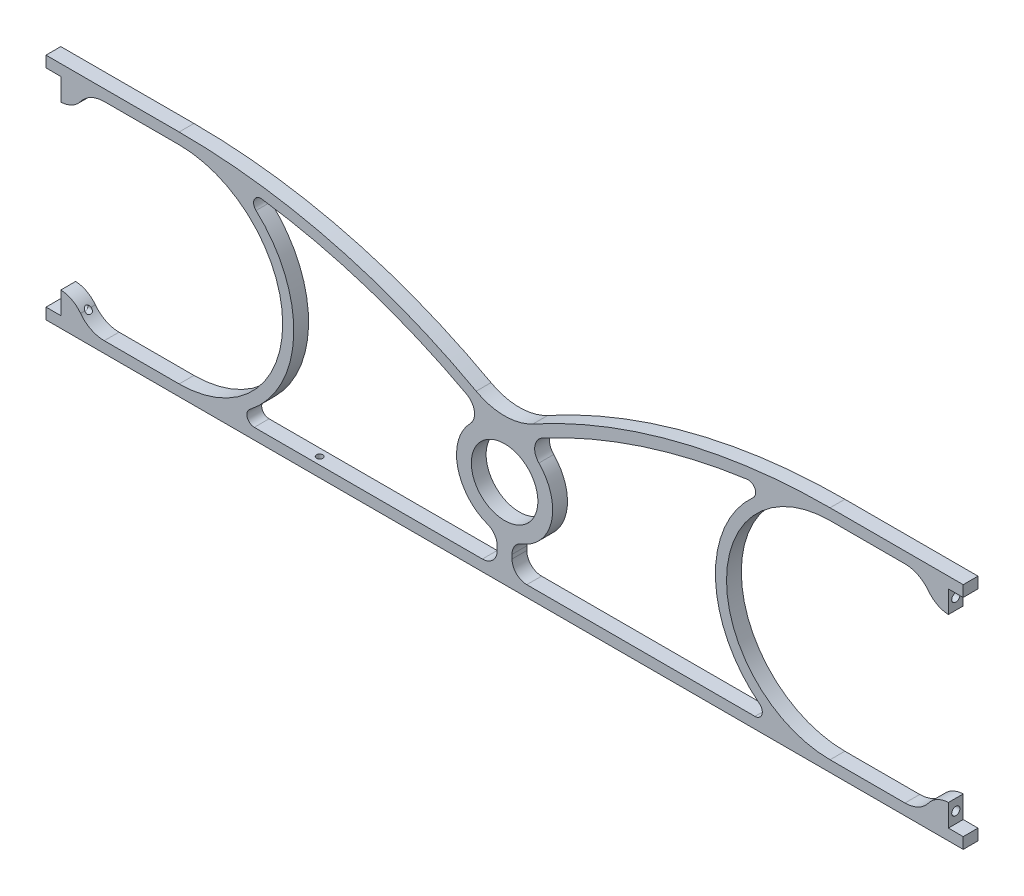
from build123d import *

# Parameters (mm, degrees)
SKETCH1_W                      = 6.35
SKETCH1_H                      = 4.7625
SKETCH1_R                      = 20.6375
SKETCH1_R_2                    = 14.2875
BOSS_EXTRUDE1_DEPTH            = 6.35
SKETCH2_W                      = 6.35
SKETCH2_H                      = 9.525
BOSS_EXTRUDE2_DEPTH            = 6.35
FILLET1_R                      = 12.7
FILLET2_R                      = 11.1125
F_6_32_TAPPED_HOLE1_D          = 2.7051
F_6_32_TAPPED_HOLE1_DEPTH      = 9.398
F_6_32_TAPPED_HOLE1_TIP        = 0.81269403
FILLET3_R                      = 25.4
FILLET4_R                      = 6.35
FILLET5_R                      = 3.175
F_6_32_TAPPED_HOLE2_AT_2_COUNT = 2
F_6_32_TAPPED_HOLE2_AT_2_PITCH = 79.375


with BuildPart() as part:
    # Sketch1 → Boss-Extrude1 (new body)
    # profile 1 of 11: a face of its own
    with BuildSketch(Plane.XY):
        with Locations((-193.675, -35.71875)):
            Rectangle(SKETCH1_W, SKETCH1_H)
    # profile 2 of 11: a face of its own
    with BuildSketch(Plane.XY):
        Polygon((190.5, -38.1), (190.5, -33.3375), (-118.579686171, -33.3375), (-190.5, -33.3375), (-190.5, -38.1), align=None)
    # profile 3 of 11: a face of its own
    with BuildSketch(Plane.XY):
        with BuildLine():
            ThreePointArc((-139.7, 55.5625), (-95.25, 11.1125), (-139.7, -33.3375))
            Line((-139.7, -33.3375), (-118.579686171, -33.3375))
            ThreePointArc((-118.579686171, -33.3375), (-90.5008099, 9.968013342), (-116.535631077, 54.53233612))
            ThreePointArc((-116.535631077, 54.53233612), (-128.106367855, 55.304831818), (-139.7, 55.5625))
        make_face()
    # profile 4 of 11: a face of its own
    with BuildSketch(Plane.XY):
        with Locations((-193.675, 57.94375)):
            Rectangle(SKETCH1_W, SKETCH1_H)
    # profile 5 of 11: a face of its own
    with BuildSketch(Plane.XY):
        with BuildLine():
            Line((-190.5, 55.5625), (-139.7, 55.5625))
            ThreePointArc((-139.7, 55.5625), (-128.106367855, 55.304831818), (-116.535631077, 54.53233612))
            ThreePointArc((-116.535631077, 54.53233612), (-59.866243781, 43.050732151), (-7.116346533, 19.371732454))
            ThreePointArc((-7.116346533, 19.371732454), (-3.614019765, 20.318594129), (0, 20.6375))
            ThreePointArc((0, 20.6375), (-67.085973021, 50.210624965), (-139.7, 60.325))
            Line((-139.7, 60.325), (-190.5, 60.325))
            Line((-190.5, 60.325), (-190.5, 55.5625))
        make_face()
    # profile 6 of 11: a face of its own
    with BuildSketch(Plane.XY):
        Circle(SKETCH1_R)
        Circle(SKETCH1_R_2, mode=Mode.SUBTRACT)
    # profile 7 of 11: a face of its own
    with BuildSketch(Plane.XY):
        with BuildLine():
            Line((-3.175, -33.3375), (3.175, -33.3375))
            Line((3.175, -33.3375), (3.175, -20.391806719))
            ThreePointArc((3.175, -20.391806719), (0, -20.6375), (-3.175, -20.391806719))
            Line((-3.175, -20.391806719), (-3.175, -33.3375))
        make_face()
    # profile 8 of 11: a face of its own
    with BuildSketch(Plane.XY):
        with BuildLine():
            ThreePointArc((116.535631077, 54.53233612), (128.106367855, 55.304831818), (139.7, 55.5625))
            Line((139.7, 55.5625), (190.5, 55.5625))
            Line((190.5, 55.5625), (190.5, 60.325))
            Line((190.5, 60.325), (139.7, 60.325))
            ThreePointArc((139.7, 60.325), (67.085973021, 50.210624965), (0, 20.6375))
            ThreePointArc((0, 20.6375), (3.614019765, 20.318594129), (7.116346533, 19.371732454))
            ThreePointArc((7.116346533, 19.371732454), (59.866243781, 43.050732151), (116.535631077, 54.53233612))
        make_face()
    # profile 9 of 11: a face of its own
    with BuildSketch(Plane.XY):
        with BuildLine():
            Line((118.579686171, -33.3375), (139.7, -33.3375))
            ThreePointArc((139.7, -33.3375), (95.25, 11.1125), (139.7, 55.5625))
            ThreePointArc((139.7, 55.5625), (128.106367855, 55.304831818), (116.535631077, 54.53233612))
            ThreePointArc((116.535631077, 54.53233612), (90.5008099, 9.968013342), (118.579686171, -33.3375))
        make_face()
    # profile 10 of 11: a face of its own
    with BuildSketch(Plane.XY):
        with Locations((193.675, 57.94375)):
            Rectangle(SKETCH1_W, SKETCH1_H)
    # profile 11 of 11: a face of its own
    with BuildSketch(Plane.XY):
        with Locations((193.675, -35.71875)):
            Rectangle(SKETCH1_W, SKETCH1_H)
    extrude(amount=-BOSS_EXTRUDE1_DEPTH)

    # Sketch2 → Boss-Extrude2 (add)
    with BuildSketch(Plane.XY):
        with Locations((-187.325, -28.575)):
            Rectangle(SKETCH2_W, SKETCH2_H)
        with Locations((-187.325, 50.8)):
            Rectangle(SKETCH2_W, SKETCH2_H)
        with Locations((187.325, 50.8)):
            Rectangle(SKETCH2_W, SKETCH2_H)
        with Locations((187.325, -28.575)):
            Rectangle(SKETCH2_W, SKETCH2_H)
    extrude(amount=-BOSS_EXTRUDE2_DEPTH)

    # Fillet1
    # the kernel refuses this fillet: 12.7 mm, written as the material it adds along each edge
    with BuildSketch(Plane(origin=(-184.15, 55.5625, 0), x_dir=(1, 0, 0), z_dir=(0, 0, -1)), Plane(origin=(184.15, -33.3375, 0), x_dir=(-1, 0, 0), z_dir=(0, 0, -1))) as fillet1_piece_1:
        with BuildLine():
            CenterArc((12.296722124, 12.7), FILLET1_R, 194.477512186, 75.522487814)
            Line((0, 9.525), (-0.245934442, 9.4615))
            ThreePointArc((-0.245934442, 9.4615), (-0.254, 4.7625), (-0.254, 0))
            Line((-0.254, 0), (0, -0.254))
            Line((0, -0.254), (12.296722124, -0.254))
            Line((12.296722124, -0.254), (12.296722124, 0))
        make_face()
    extrude(amount=6.35)
    with BuildSketch(Plane(origin=(184.15, 55.5625, 0), x_dir=(-1, 0, 0), z_dir=(0, 0, -1)), Plane(origin=(-184.15, -33.3375, 0), x_dir=(1, 0, 0), z_dir=(0, 0, -1))) as fillet1_piece_2:
        with BuildLine():
            CenterArc((12.296722124, -12.7), FILLET1_R, 90, 75.522487814)
            Line((0, -9.525), (-0.245934442, -9.4615))
            ThreePointArc((-0.245934442, -9.4615), (-0.254, -4.7625), (-0.254, 0))
            Line((-0.254, 0), (0, 0.254))
            Line((0, 0.254), (12.296722124, 0.254))
            Line((12.296722124, 0.254), (12.296722124, 0))
        make_face()
    extrude(amount=6.35)

    # Fillet2
    # the kernel refuses this fillet: 11.1125 mm, written as the material it takes off along each edge
    with BuildSketch(Plane(origin=(184.15, -23.8125, 15.875), x_dir=(-0.43306748122172567, -0.9013615016785831, 0), z_dir=(0, 0, -1)), Plane(origin=(-184.15, 46.0375, 15.875), x_dir=(0.43306748122172517, 0.9013615016785834, 0), z_dir=(0, 0, -1))) as fillet2_piece_1:
        with BuildLine():
            CenterArc((7.082527166, -10.901433526), FILLET2_R, 101.184876129, 51.043876357)
            Line((-2.749978506, -5.723645536), (-2.946628619, -5.620089776))
            ThreePointArc((-2.946628619, -5.620089776), (-1.575316847, -2.76557352), (-0.200327594, 0.096249248))
            Line((-0.200327594, 0.096249248), (0.043111035, 0.218028671))
            ThreePointArc((0.043111035, 0.218028671), (2.46348771, -0.018968828), (4.883864385, 0.218028671))
            Line((4.883864385, 0.218028671), (4.92697542, 0))
        make_face()
    extrude(amount=38.1, mode=Mode.SUBTRACT)
    with BuildSketch(Plane(origin=(184.15, 46.0375, 15.875), x_dir=(1, 0, 0), z_dir=(0, 0, -1)), Plane(origin=(-184.15, -23.8125, 15.875), x_dir=(-1, 0, 0), z_dir=(0, 0, -1))) as fillet2_piece_2:
        with BuildLine():
            CenterArc((6.758920293, -11.10497368), FILLET2_R, 92.108859198, 51.043876357)
            Line((-2.133712835, -4.440985963), (-2.311565498, -4.307706209))
            ThreePointArc((-2.311565498, -4.307706209), (-1.049758647, -2.228707764), (-0.215192637, 0.0555625))
            Line((-0.215192637, 0.0555625), (0, 0.22225))
            ThreePointArc((0, 0.22225), (3.175, 0.22225), (6.341821594, 0.222099474))
            Line((6.341821594, 0.222099474), (6.35, 0))
        make_face()
    extrude(amount=38.1, mode=Mode.SUBTRACT)

    # #6-32 Tapped Hole1
    with Locations(Plane(origin=(0, -38.1, 0), x_dir=(-1, 0, 0), z_dir=(0, -1, 0))):
        with Locations((82.55, 3.175)):
            Hole(F_6_32_TAPPED_HOLE1_D / 2, depth=F_6_32_TAPPED_HOLE1_DEPTH)
            with Locations((0, 0, -(F_6_32_TAPPED_HOLE1_DEPTH + F_6_32_TAPPED_HOLE1_TIP / 2))):  # 118° drill point
                Cone(0, F_6_32_TAPPED_HOLE1_D / 2, F_6_32_TAPPED_HOLE1_TIP, mode=Mode.SUBTRACT)

    # Fillet3
    fillet3_edges = [part.edges().sort_by_distance(p)[0] for p in [
        (0, 20.6375, -3.175),
    ]]
    fillet(fillet3_edges, radius=FILLET3_R)

    # Fillet4
    fillet4_edges = [part.edges().sort_by_distance(p)[0] for p in [
        (3.175, -20.391806719, -3.175),
        (3.175, -33.3375, -3.175),
        (7.116346533, 19.371732454, -3.175),
        (-3.175, -33.3375, -3.175),
        (-3.175, -20.391806719, -3.175),
        (-7.116346533, 19.371732454, -3.175),
    ]]
    fillet(fillet4_edges, radius=FILLET4_R)

    # Fillet5
    fillet5_edges = [part.edges().sort_by_distance(p)[0] for p in [
        (118.579686171, -33.3375, -3.175),
        (116.535631077, 54.53233612, -3.175),
        (-116.535631077, 54.53233612, -3.175),
        (-118.579686171, -33.3375, -3.175),
    ]]
    fillet(fillet5_edges, radius=FILLET5_R)

    # Sketch7 → #6-32 Tapped Hole2 (revolve, cut)
    with BuildSketch(Plane(origin=(190.5, -28.575, -3.175), x_dir=(0, 0, -1), z_dir=(0, 1, 0))):
        Polygon((0, 0), (0, 10.21069403), (1.35255, 9.398), (1.35255, 7.112), (1.7526, 7.112), (1.7526, 0), align=None)
    f_6_32_tapped_hole2 = revolve(axis=Axis((196.85, -28.575, -3.175), (-1, 0, 0)), mode=Mode.SUBTRACT)

    # #6-32 Tapped Hole2 at 2: #6-32 Tapped Hole2 ×2
    with Locations(*[(0, i * F_6_32_TAPPED_HOLE2_AT_2_PITCH, 0) for i in range(1, F_6_32_TAPPED_HOLE2_AT_2_COUNT)]):
        add(f_6_32_tapped_hole2, mode=Mode.SUBTRACT)

    # Mirror1: #6-32 Tapped Hole2 across plane
    add(f_6_32_tapped_hole2.mirror(Plane(origin=(0, 0, 0), x_dir=(0, 0, 1), z_dir=(1, 0, 0))), mode=Mode.SUBTRACT)

    # Mirror1 copy 1 sketch → Mirror1 copy 1 (revolve, cut)
    with BuildSketch(Plane(origin=(-190.5, 50.8, -3.175), x_dir=(0, 0, -1), z_dir=(0, 1, 0))):
        Polygon((0, 0), (0, -10.21069403), (1.35255, -9.398), (1.35255, -7.112), (1.7526, -7.112), (1.7526, 0), align=None)
    revolve(axis=Axis((-196.85, 50.8, -3.175), (-1, 0, 0)), mode=Mode.SUBTRACT)


solid = part.part
